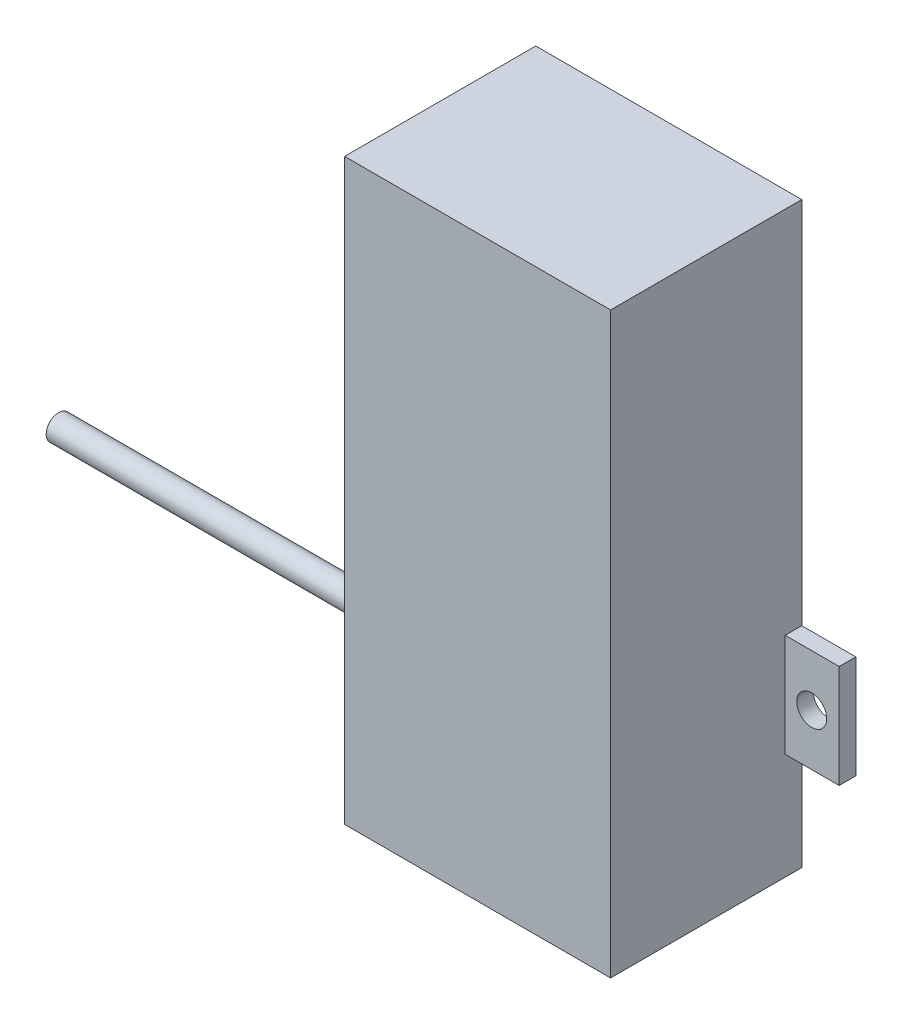
from build123d import *

# Parameters (mm, degrees)
SKETCH_1_W            = 32
SKETCH_1_H            = 69.6
EXTRUDE_1_DEPTH       = 23
SKETCH_2_R            = 1.5
EXTRUDE_2_DEPTH       = 45.9
SKETCH_3_W            = 2
SKETCH_3_H            = 3.6
EXTRUDE_3_DEPTH       = 4.5
SKETCH_5_W            = 16
SKETCH_5_H            = 23
CUT_EXTRUDE_1_DEPTH   = 71.5
SKETCH_6_W            = 4.5
SKETCH_6_H            = 3.6
CUT_EXTRUDE_2_DEPTH   = 1
SKETCH_7_W            = 2
SKETCH_7_H            = 4.4
EXTRUDE_4_DEPTH       = 6.5
SKETCH_9_W            = 1
SKETCH_9_H            = 1.8
CUT_EXTRUDE_3_DEPTH   = 4.5
SKETCH_10_W           = 1.5
SKETCH_10_H           = 2
EXTRUDE_5_DEPTH       = 4.5
MIRROR_START          = 34.279062003
MIRROR_25_OUTLINE_W   = 69.6
MIRROR_25_OUTLINE_H   = 23
MIRROR_25_DEPTH       = 16
MIRROR_START_2        = -11.620937997
MIRROR_25_2_OUTLINE_R = 1.5
MIRROR_25_2_DEPTH     = 45.9
MIRROR_START_3        = 27.779062003
MIRROR_25_3_OUTLINE_W = 4.4
MIRROR_25_3_OUTLINE_H = 2
MIRROR_25_3_DEPTH     = 6.5
MIRROR_25_4_OUTLINE_W = 4.5
MIRROR_25_4_OUTLINE_H = 2
MIRROR_25_4_DEPTH     = 1.5
SKETCH_12_W           = 2
SKETCH_12_H           = 4.395113111
EXTRUDE_6_DEPTH       = 7.5
SKETCH_15_W           = 2
SKETCH_15_H           = 3.6
EXTRUDE_7_DEPTH       = 6
SKETCH_14_R           = 1.801767182
CUT_EXTRUDE_4_DEPTH   = 6
SKETCH_17_W           = 2
SKETCH_17_H           = 4.5
EXTRUDE_8_DEPTH       = 6
SKETCH_16_R           = 1.798109405
CUT_EXTRUDE_5_DEPTH   = 6
CUT_EXTRUDE_START     = -45.9
SKETCH_18_R           = 1.5
CUT_EXTRUDE_6_DEPTH   = 45.9


# Read off the part's stored shape, not the designer's step: ﾐﾗｰ25
with BuildPart() as part:
    # ｽｹｯﾁ1 → ﾎﾞｽ - 押し出し1 (new body)
    with BuildSketch(Plane.XY):
        with Locations((50.279062003, -5.527058824)):
            Rectangle(SKETCH_1_W, SKETCH_1_H)
    extrude(amount=EXTRUDE_1_DEPTH)

    # ｽｹｯﾁ2 → ﾎﾞｽ - 押し出し2 (add)
    with BuildSketch(Plane(origin=(66.279062003, 0, 0), x_dir=(0, 0, -1), z_dir=(1, 0, 0))):
        with Locations(Location((-11.5, -27.627058824, 0), (0, 0, 180))):
            Circle(SKETCH_2_R)
    extrude(amount=EXTRUDE_2_DEPTH)

    # ｽｹｯﾁ3 → ﾎﾞｽ - 押し出し3 (add)
    with BuildSketch(Plane(origin=(66.279062003, 0, 0), x_dir=(0, 0, -1), z_dir=(1, 0, 0))):
        with Locations((-1, -21.322089651)):
            Rectangle(SKETCH_3_W, SKETCH_3_H)
    extrude(amount=EXTRUDE_3_DEPTH)

    # ｽｹｯﾁ5 → ｶｯﾄ - 押し出し1 (cut)
    with BuildSketch(Plane(origin=(0, 29.272941176, 0), x_dir=(1, 0, 0), z_dir=(0, 1, 0))):
        with Locations((42.279062003, -11.5)):
            Rectangle(SKETCH_5_W, SKETCH_5_H)
    extrude(amount=-CUT_EXTRUDE_1_DEPTH, mode=Mode.SUBTRACT)

    # ｽｹｯﾁ6 → ｶｯﾄ - 押し出し2 (cut)
    with BuildSketch(Plane.XY.offset(2)):
        with Locations((68.529062003, -21.322089651)):
            Rectangle(SKETCH_6_W, SKETCH_6_H)
    extrude(amount=-CUT_EXTRUDE_2_DEPTH, mode=Mode.SUBTRACT)

    # ｽｹｯﾁ7 → ﾎﾞｽ - 押し出し4 (add)
    with BuildSketch(Plane(origin=(66.279062003, 0, 0), x_dir=(0, 0, -1), z_dir=(1, 0, 0))):
        with Locations((-1, -17.322089651)):
            Rectangle(SKETCH_7_W, SKETCH_7_H)
    extrude_4 = extrude(amount=EXTRUDE_4_DEPTH)

    # ｽｹｯﾁ9 → ｶｯﾄ - 押し出し3 (cut)
    with BuildSketch(Plane(origin=(70.779062003, 0, 0), x_dir=(0, 0, -1), z_dir=(1, 0, 0))):
        with Locations((-0.5, -22.222089651)):
            Rectangle(SKETCH_9_W, SKETCH_9_H)
    cut_extrude_3 = extrude(amount=-CUT_EXTRUDE_3_DEPTH, mode=Mode.SUBTRACT)

    # ﾐﾗｰ4: ﾎﾞｽ - 押し出し4, ｶｯﾄ - 押し出し3 across plane
    add(extrude_4.mirror(Plane(origin=(66.279062003, -21.322089651, 1), x_dir=(0, 0, 1), z_dir=(0, 1, 0))))
    add(cut_extrude_3.mirror(Plane(origin=(66.279062003, -21.322089651, 1), x_dir=(0, 0, 1), z_dir=(0, 1, 0))), mode=Mode.SUBTRACT)

    # ｽｹｯﾁ10 → ﾎﾞｽ - 押し出し5 (add)
    with BuildSketch(Plane.XZ.offset(19.522089651)):
        with Locations((72.029062003, 1)):
            Rectangle(SKETCH_10_W, SKETCH_10_H)
    extrude(amount=EXTRUDE_5_DEPTH)

    # ﾐﾗｰ25 outline → ﾐﾗｰ25 (add)
    with BuildSketch(Plane.YZ.offset(MIRROR_START)):
        with Locations((-5.527058824, 11.5)):
            Rectangle(MIRROR_25_OUTLINE_W, MIRROR_25_OUTLINE_H)
    extrude(amount=MIRROR_25_DEPTH)

    # Mirror 25 2 outline → Mirror 25 2 (add)
    with BuildSketch(Plane.YZ.offset(MIRROR_START_2)):
        with Locations((-27.627058824, 11.5)):
            Circle(MIRROR_25_2_OUTLINE_R)
    extrude(amount=MIRROR_25_2_DEPTH)

    # Mirror 25 3 outline → Mirror 25 3 (add)
    with BuildSketch(Plane.YZ.offset(MIRROR_START_3)):
        with Locations((-17.322089651, 1)):
            Rectangle(MIRROR_25_3_OUTLINE_W, MIRROR_25_3_OUTLINE_H)
    extrude(amount=MIRROR_25_3_DEPTH)

    # Mirror 25 4 outline → Mirror 25 4 (add)
    with BuildSketch(Plane.YZ.offset(MIRROR_START_3)):
        with Locations((-21.772089651, 1)):
            Rectangle(MIRROR_25_4_OUTLINE_W, MIRROR_25_4_OUTLINE_H)
    extrude(amount=MIRROR_25_4_DEPTH)

    # ｽｹｯﾁ12 → ﾎﾞｽ - 押し出し6 (add)
    with BuildSketch(Plane.ZY.offset(-27.779062003)):
        with Locations((1, -26.219646207)):
            Rectangle(SKETCH_12_W, SKETCH_12_H)
    extrude(amount=-EXTRUDE_6_DEPTH)

    # ｽｹｯﾁ15 → ﾎﾞｽ - 押し出し7 (add)
    with BuildSketch(Plane(origin=(66.279062003, 0, 0), x_dir=(0, 0, -1), z_dir=(1, 0, 0))):
        with Locations((-1, -21.322089651)):
            Rectangle(SKETCH_15_W, SKETCH_15_H)
    extrude(amount=EXTRUDE_7_DEPTH)

    # ｽｹｯﾁ14 → ｶｯﾄ - 押し出し4 (cut)
    with BuildSketch(Plane.XY.offset(2)):
        with Locations((69.477294821, -21.322089651)):
            Circle(SKETCH_14_R)
    extrude(amount=-CUT_EXTRUDE_4_DEPTH, mode=Mode.SUBTRACT)

    # ｽｹｯﾁ17 → ﾎﾞｽ - 押し出し8 (add)
    with BuildSketch(Plane.ZY.offset(-34.279062003)):
        with Locations((1, -21.772089651)):
            Rectangle(SKETCH_17_W, SKETCH_17_H)
    extrude(amount=EXTRUDE_8_DEPTH)

    # ｽｹｯﾁ16 → ｶｯﾄ - 押し出し5 (cut)
    with BuildSketch(Plane.XY.offset(2)):
        with Locations((31.077171408, -21.772089651)):
            Circle(SKETCH_16_R)
    extrude(amount=-CUT_EXTRUDE_5_DEPTH, mode=Mode.SUBTRACT)

    # ｽｹｯﾁ18 → ｶｯﾄ - 押し出し6 (cut)
    with BuildSketch(Plane(origin=(112.179062003, 0, 0), x_dir=(0, 0, -1), z_dir=(1, 0, 0)).offset(CUT_EXTRUDE_START)):
        with Locations((-11.5, -27.627058824)):
            Circle(SKETCH_18_R)
    extrude(amount=CUT_EXTRUDE_6_DEPTH, mode=Mode.SUBTRACT)


solid = part.part
